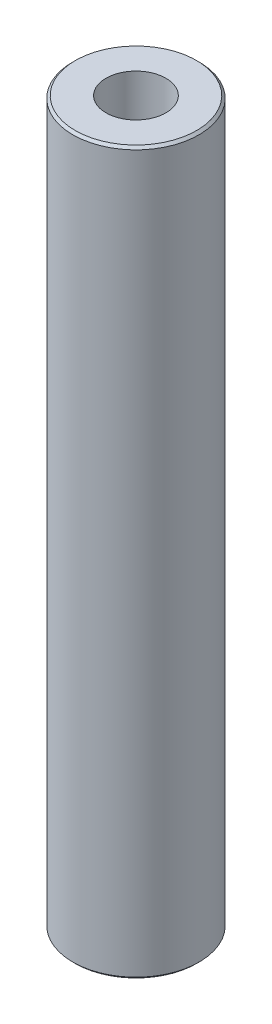
from build123d import *

# Parameters (mm, degrees)
SKETCH1_R           = 52.5
BOSS_EXTRUDE1_DEPTH = 600
SKETCH2_R           = 24.943209722
CUT_EXTRUDE1_DEPTH  = 605.576297914
CHAMFER1_SIZE       = 2.033605588


with BuildPart() as part:
    # Sketch1 → Boss-Extrude1 (new body)
    with BuildSketch(Plane(origin=(0, 0, 0), x_dir=(1, 0, 0), z_dir=(0, 1, 0))):
        Circle(SKETCH1_R)
    extrude(amount=BOSS_EXTRUDE1_DEPTH)

    # Sketch2 → Cut-Extrude1 (cut, through all)
    with BuildSketch(Plane(origin=(0, 0, 0), x_dir=(1, 0, 0), z_dir=(0, 1, 0))):
        Circle(SKETCH2_R)
    extrude(amount=CUT_EXTRUDE1_DEPTH, mode=Mode.SUBTRACT)

    # Chamfer1
    chamfer1_edges = [part.edges().sort_by_distance(p)[0] for p in [
        (-52.5, 600, 0),
        (-52.5, 0, 0),
    ]]
    chamfer(chamfer1_edges, length=CHAMFER1_SIZE)


solid = part.part
